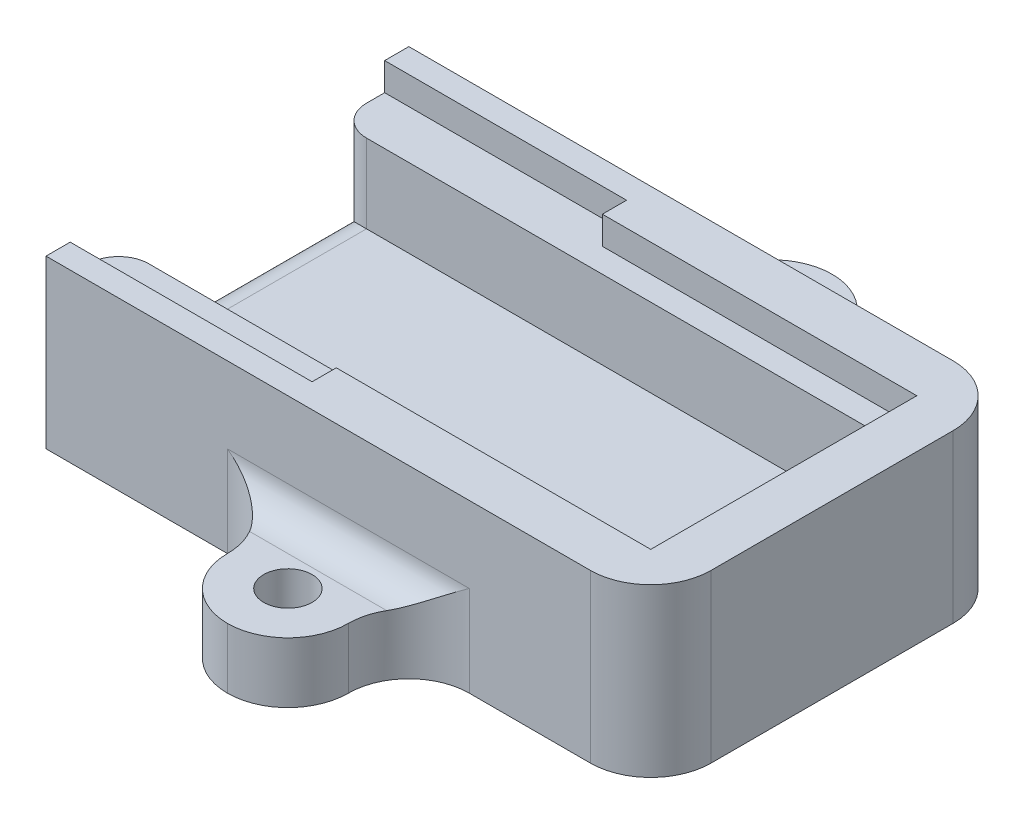
from build123d import *

# Parameters (mm, degrees)
SKETCH2_R           = 2
BOSS_EXTRUDE1_DEPTH = 5
FILLET1_START       = -1
FILLET1_DEPTH       = 7
FILLET1_2_DEPTH     = 5
BOSS_EXTRUDE2_DEPTH = 8.8
SKETCH4_W           = 22
SKETCH4_H           = 2.3
CUT_EXTRUDE1_DEPTH  = 46
SKETCH5_W           = 2
SKETCH5_H           = 2.3
CUT_EXTRUDE2_DEPTH  = 20
FILLET2_R           = 5
FILLET3_R           = 2.5


with BuildPart() as part:
    # Sketch2 → Boss-Extrude1 (new body)
    with BuildSketch(Plane(origin=(0, 0, 0), x_dir=(1, 0, 0), z_dir=(0, 1, 0))):
        Polygon((5, 12.5), (25, 12.5), (25, -17.5), (5, -17.5), (5, -27.5), (-5, -27.5), (-5, -17.5), (-25, -17.5), (-25, 12.5), (-5, 12.5), (-5, 22.5), (5, 22.5), align=None)
        with Locations(Location((0, 17.5, 0), (0, 0, 270))):
            Circle(SKETCH2_R, mode=Mode.SUBTRACT)
        with Locations(Location((0, -22.5, 0), (0, 0, 90))):
            Circle(SKETCH2_R, mode=Mode.SUBTRACT)
    extrude(amount=BOSS_EXTRUDE1_DEPTH)

    # Fillet1: read off the stored shape, not the designer's step
    # Fillet1 outline → Fillet1 (cut)
    with BuildSketch(Plane(origin=(0, 0, 0), x_dir=(1, 0, 0), z_dir=(0, 1, 0)).offset(FILLET1_START)):
        with BuildLine():
            ThreePointArc((5, -22.5), (3.535533906, -26.035533906), (0, -27.5))
            Line((0, -27.5), (5, -27.5))
            Line((5, -27.5), (5, -22.5))
        make_face()
        with BuildLine():
            ThreePointArc((0, -27.5), (-3.535533906, -26.035533906), (-5, -22.5))
            Line((-5, -22.5), (-5, -27.5))
            Line((-5, -27.5), (0, -27.5))
        make_face()
        with BuildLine():
            ThreePointArc((-5, 17.5), (-3.535533906, 21.035533906), (0, 22.5))
            Line((0, 22.5), (-5, 22.5))
            Line((-5, 22.5), (-5, 17.5))
        make_face()
        with BuildLine():
            ThreePointArc((0, 22.5), (3.535533906, 21.035533906), (5, 17.5))
            Line((5, 17.5), (5, 22.5))
            Line((5, 22.5), (0, 22.5))
        make_face()
    extrude(amount=FILLET1_DEPTH, mode=Mode.SUBTRACT)

    # Fillet1 2 outline → Fillet1 2 (add)
    with BuildSketch(Plane(origin=(0, 0, 0), x_dir=(1, 0, 0), z_dir=(0, 1, 0))):
        with BuildLine():
            Line((5, -17.5), (5, -22.5))
            ThreePointArc((5, -22.5), (6.464466094, -18.964466094), (10, -17.5))
            Line((10, -17.5), (5, -17.5))
        make_face()
        with BuildLine():
            ThreePointArc((-10, -17.5), (-6.464466094, -18.964466094), (-5, -22.5))
            Line((-5, -22.5), (-5, -17.5))
            Line((-5, -17.5), (-10, -17.5))
        make_face()
        with BuildLine():
            Line((-5, 12.5), (-5, 17.5))
            ThreePointArc((-5, 17.5), (-6.464466094, 13.964466094), (-10, 12.5))
            Line((-10, 12.5), (-5, 12.5))
        make_face()
        with BuildLine():
            ThreePointArc((10, 12.5), (6.464466094, 13.964466094), (5, 17.5))
            Line((5, 17.5), (5, 12.5))
            Line((5, 12.5), (10, 12.5))
        make_face()
    extrude(amount=FILLET1_2_DEPTH)

    # Sketch3 → Boss-Extrude2 (add)
    with BuildSketch(Plane(origin=(0, 5, 0), x_dir=(1, 0, 0), z_dir=(0, 1, 0))):
        Polygon((-25, -11.5), (-25, -17.5), (25, -17.5), (25, 12.5), (-25, 12.5), (-25, 6.5), (19, 6.5), (19, -11.5), align=None)
    extrude(amount=BOSS_EXTRUDE2_DEPTH)

    # Sketch4 → Cut-Extrude1 (cut)
    with BuildSketch(Plane.ZY.offset(25)):
        with Locations((2.5, 12.65)):
            Rectangle(SKETCH4_W, SKETCH4_H)
    extrude(amount=-CUT_EXTRUDE1_DEPTH, mode=Mode.SUBTRACT)

    # Sketch5 → Cut-Extrude2 (cut)
    with BuildSketch(Plane.ZY.offset(25)):
        with Locations((-9.5, 12.65)):
            Rectangle(SKETCH5_W, SKETCH5_H)
        with Locations((14.5, 12.65)):
            Rectangle(SKETCH5_W, SKETCH5_H)
    extrude(amount=-CUT_EXTRUDE2_DEPTH, mode=Mode.SUBTRACT)

    # Fillet2
    fillet2_edges = [part.edges().sort_by_distance(p)[0] for p in [
        (25, 6.9, 17.5),
        (25, 6.9, -12.5),
    ]]
    fillet(fillet2_edges, radius=FILLET2_R)

    # Fillet3
    fillet3_edges = [part.edges().sort_by_distance(p)[0] for p in [
        (-25, 8.25, 11.5),
        (-25, 8.25, -6.5),
        (-25, 5, 2.5),
        (0, 5, 17.5),
        (0, 5, -12.5),
    ]]
    fillet(fillet3_edges, radius=FILLET3_R)


solid = part.part
